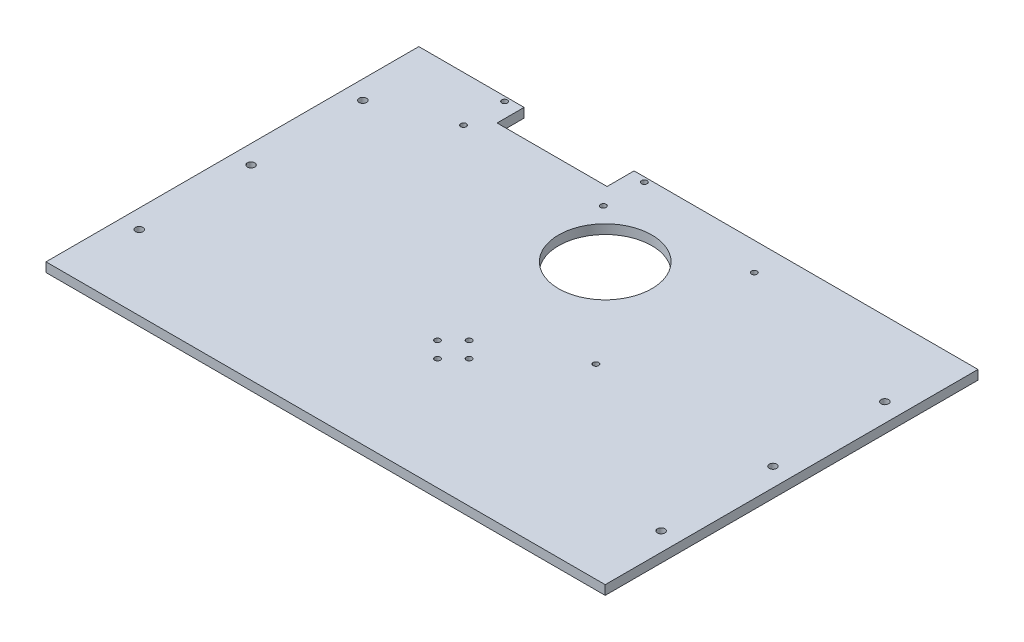
from build123d import *

# Parameters (mm, degrees)
SKETCH1_W           = 300
SKETCH1_H           = 200
BOSS_EXTRUDE1_DEPTH = 5
SKETCH2_R           = 2
SKETCH2_R_2         = 25
CUT_EXTRUDE2_DEPTH  = 181.346887969
SKETCH4_R           = 1.5
CUT_EXTRUDE3_DEPTH  = 181.346887969
SKETCH6_W           = 59
SKETCH6_H           = 14.5
CUT_EXTRUDE4_DEPTH  = 5
SKETCH7_R           = 1.5
CUT_EXTRUDE5_DEPTH  = 181.346887969
SKETCH8_R           = 1.5
CUT_EXTRUDE6_DEPTH  = 181.346887969


with BuildPart() as part:
    # Sketch1 → Boss-Extrude1 (new body)
    with BuildSketch(Plane(origin=(0, 0, 0), x_dir=(1, 0, 0), z_dir=(0, 1, 0))):
        Rectangle(SKETCH1_W, SKETCH1_H)
    extrude(amount=BOSS_EXTRUDE1_DEPTH)

    # Sketch2 → Cut-Extrude2 (cut, through all)
    with BuildSketch(Plane(origin=(0, 5, 0), x_dir=(1, 0, 0), z_dir=(0, 1, 0))):
        with Locations((-140, 0)):
            Circle(SKETCH2_R)
        with Locations((-140, 60)):
            Circle(SKETCH2_R)
        with Locations((-140, -60)):
            Circle(SKETCH2_R)
        with Locations((140, -60)):
            Circle(SKETCH2_R)
        with Locations((140, 60)):
            Circle(SKETCH2_R)
        with Locations((140, 0)):
            Circle(SKETCH2_R)
        with Locations((0, 50)):
            Circle(SKETCH2_R_2)
    extrude(amount=-CUT_EXTRUDE2_DEPTH, mode=Mode.SUBTRACT)

    # Sketch4 → Cut-Extrude3 (cut, through all)
    with BuildSketch(Plane(origin=(0, 5, 0), x_dir=(1, 0, 0), z_dir=(0, 1, 0))):
        with Locations((-101.5, 97.5)):
            Circle(SKETCH4_R)
        with Locations((-26.5, 97.5)):
            Circle(SKETCH4_R)
        with Locations((-26.5, 75.5)):
            Circle(SKETCH4_R)
        with Locations((-101.5, 75.5)):
            Circle(SKETCH4_R)
    extrude(amount=-CUT_EXTRUDE3_DEPTH, mode=Mode.SUBTRACT)

    # Sketch6 → Cut-Extrude4 (cut)
    with BuildSketch(Plane.XZ):
        with Locations((-64, -92.75)):
            Rectangle(SKETCH6_W, SKETCH6_H)
    extrude(amount=-CUT_EXTRUDE4_DEPTH, mode=Mode.SUBTRACT)

    # Sketch7 → Cut-Extrude5 (cut, through all)
    with BuildSketch(Plane(origin=(0, 5, 0), x_dir=(1, 0, 0), z_dir=(0, 1, 0))):
        with Locations((0, -23)):
            Circle(SKETCH7_R)
        with Locations((0, -40)):
            Circle(SKETCH7_R)
        with Locations((-8.5, -31.5)):
            Circle(SKETCH7_R)
        with Locations((8.5, -31.5)):
            Circle(SKETCH7_R)
    extrude(amount=-CUT_EXTRUDE5_DEPTH, mode=Mode.SUBTRACT)

    # Sketch8 → Cut-Extrude6 (cut, through all)
    with BuildSketch(Plane(origin=(0, 5, 0), x_dir=(1, 0, 0), z_dir=(0, 1, 0))):
        with Locations((45, 85)):
            Circle(SKETCH8_R)
        with Locations((45, 0)):
            Circle(SKETCH8_R)
    extrude(amount=-CUT_EXTRUDE6_DEPTH, mode=Mode.SUBTRACT)


solid = part.part
